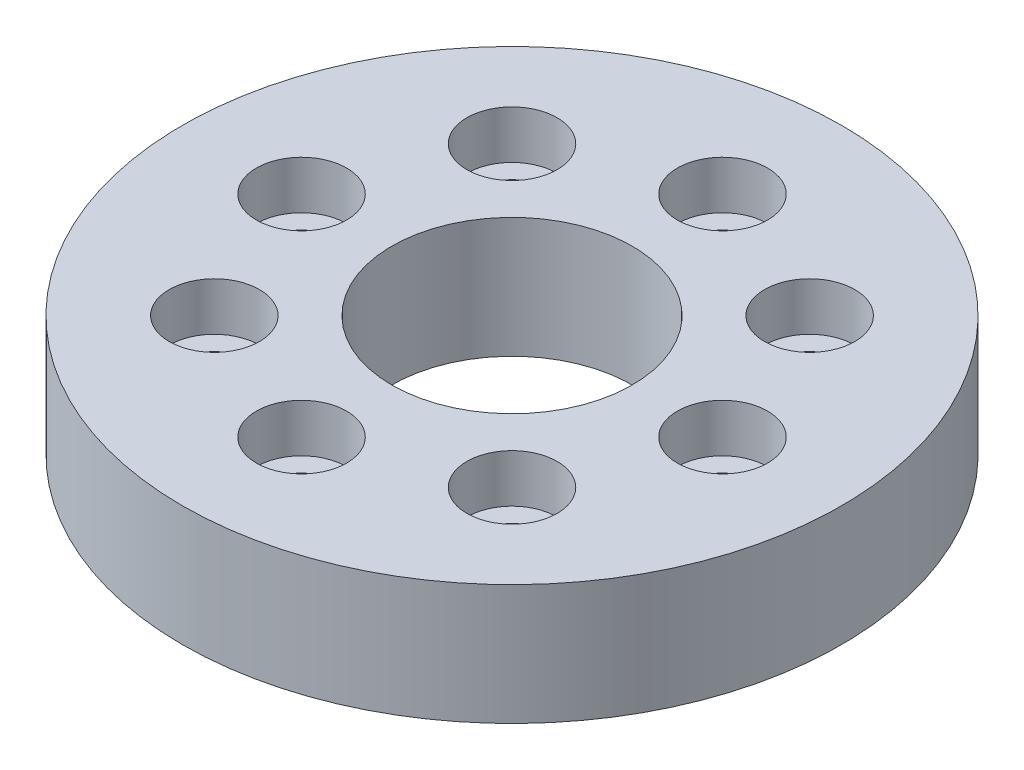
from build123d import *

# Parameters (mm, degrees)
SKETCH1_R           = 27.4
SKETCH1_R_2         = 2
SKETCH1_R_3         = 10
BOSS_EXTRUDE1_DEPTH = 10
SKETCH2_R           = 3.75
CUT_EXTRUDE1_DEPTH  = 4


with BuildPart() as part:
    # Sketch1 → Boss-Extrude1 (new body)
    with BuildSketch(Plane(origin=(0, 0, 0), x_dir=(1, 0, 0), z_dir=(0, 1, 0))):
        Circle(SKETCH1_R)
        with Locations((0, 17.5)):
            Circle(SKETCH1_R_2, mode=Mode.SUBTRACT)
        with Locations((0, -17.5)):
            Circle(SKETCH1_R_2, mode=Mode.SUBTRACT)
        with Locations((-12.374368671, -12.374368671)):
            Circle(SKETCH1_R_2, mode=Mode.SUBTRACT)
        with Locations((12.374368671, -12.374368671)):
            Circle(SKETCH1_R_2, mode=Mode.SUBTRACT)
        with Locations((17.5, 0)):
            Circle(SKETCH1_R_2, mode=Mode.SUBTRACT)
        with Locations((-17.5, 0)):
            Circle(SKETCH1_R_2, mode=Mode.SUBTRACT)
        with Locations((-12.374368671, 12.374368671)):
            Circle(SKETCH1_R_2, mode=Mode.SUBTRACT)
        Circle(SKETCH1_R_3, mode=Mode.SUBTRACT)
        with Locations((12.374368671, 12.374368671)):
            Circle(SKETCH1_R_2, mode=Mode.SUBTRACT)
    extrude(amount=BOSS_EXTRUDE1_DEPTH)

    # Sketch2 → Cut-Extrude1 (cut)
    with BuildSketch(Plane(origin=(0, 10, 0), x_dir=(1, 0, 0), z_dir=(0, 1, 0))):
        with Locations((-12.374368671, 12.374368671)):
            Circle(SKETCH2_R)
        with Locations((0, 17.5)):
            Circle(SKETCH2_R)
        with Locations((12.374368671, 12.374368671)):
            Circle(SKETCH2_R)
        with Locations((17.5, 0)):
            Circle(SKETCH2_R)
        with Locations((12.374368671, -12.374368671)):
            Circle(SKETCH2_R)
        with Locations((0, -17.5)):
            Circle(SKETCH2_R)
        with Locations((-12.374368671, -12.374368671)):
            Circle(SKETCH2_R)
        with Locations((-17.5, 0)):
            Circle(SKETCH2_R)
    extrude(amount=-CUT_EXTRUDE1_DEPTH, mode=Mode.SUBTRACT)


solid = part.part
